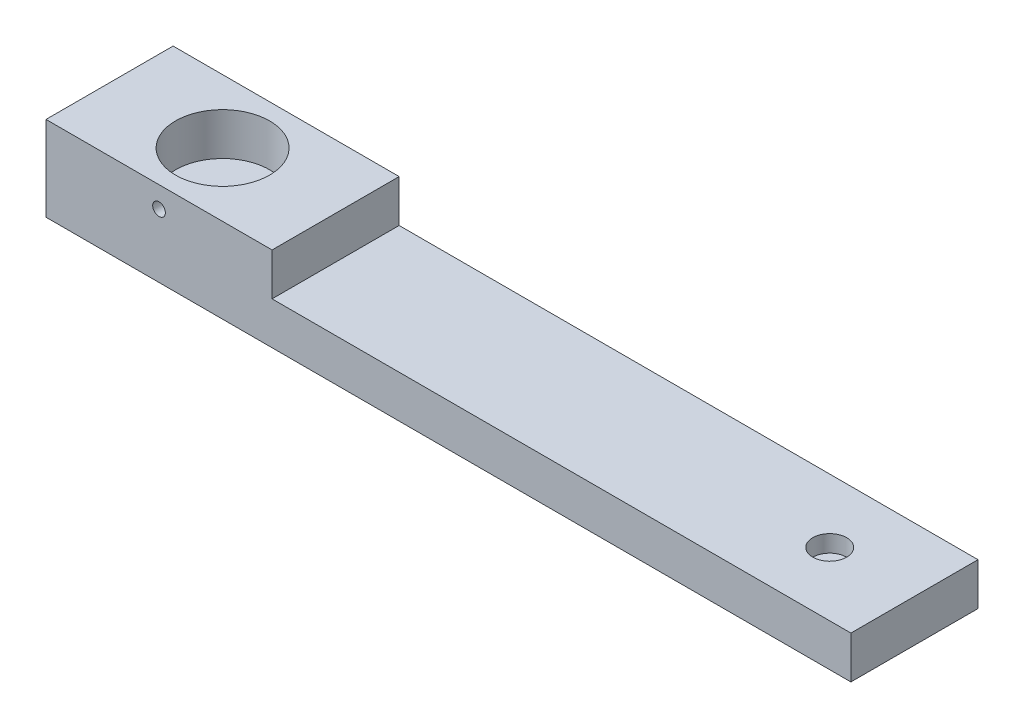
from build123d import *

# Parameters (mm, degrees)
SKETCH1_W           = 190
SKETCH1_H           = 30
BOSS_EXTRUDE1_DEPTH = 10
SKETCH2_W           = 53.364401409
SKETCH2_H           = 30
SKETCH2_R           = 11.1
BOSS_EXTRUDE3_DEPTH = 10
SKETCH6_R           = 1.5
CUT_EXTRUDE2_DEPTH  = 10
SKETCH4_R           = 4
CUT_EXTRUDE3_DEPTH  = 4
SKETCH7_R           = 1.5
CUT_EXTRUDE4_DEPTH  = 14


with BuildPart() as part:
    # Sketch1 → Boss-Extrude1 (new body)
    with BuildSketch(Plane(origin=(0, 0, 0), x_dir=(1, 0, 0), z_dir=(0, 1, 0))):
        Rectangle(SKETCH1_W, SKETCH1_H)
    extrude(amount=BOSS_EXTRUDE1_DEPTH)

    # Sketch2 → Boss-Extrude3 (add)
    with BuildSketch(Plane(origin=(0, 10, 0), x_dir=(1, 0, 0), z_dir=(0, 1, 0))):
        with Locations((-68.317799296, 0)):
            Rectangle(SKETCH2_W, SKETCH2_H)
        with Locations((-68.317799296, 0)):
            Circle(SKETCH2_R, mode=Mode.SUBTRACT)
    extrude(amount=BOSS_EXTRUDE3_DEPTH)

    # Sketch6 → Cut-Extrude2 (cut)
    with BuildSketch(Plane.XY.offset(15)):
        with Locations((-68.317799296, 15)):
            Circle(SKETCH6_R)
    extrude(amount=-CUT_EXTRUDE2_DEPTH, mode=Mode.SUBTRACT)

    # Sketch4 → Cut-Extrude3 (cut)
    with BuildSketch(Plane(origin=(0, 10, 0), x_dir=(1, 0, 0), z_dir=(0, 1, 0))):
        with Locations((75, 0)):
            Circle(SKETCH4_R)
    extrude(amount=-CUT_EXTRUDE3_DEPTH, mode=Mode.SUBTRACT)

    # Sketch7 → Cut-Extrude4 (cut)
    with BuildSketch(Plane(origin=(0, 6, 0), x_dir=(1, 0, 0), z_dir=(0, 1, 0))):
        with Locations((75, 0)):
            Circle(SKETCH7_R)
    extrude(amount=-CUT_EXTRUDE4_DEPTH, mode=Mode.SUBTRACT)


solid = part.part
